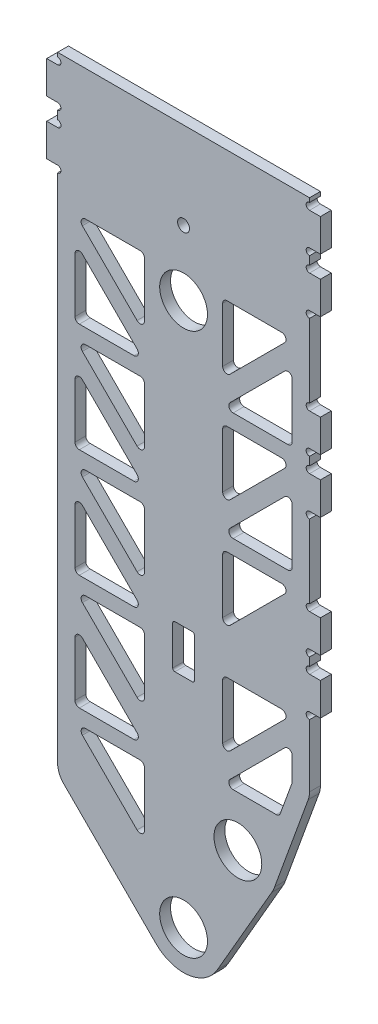
from build123d import *
from build123d.topology import SkipClean

# Parameters (mm, degrees)
SKETCH_1_R                  = 11
EXTRUDE_567_DEPTH           = 100
EXTRUDE_START               = -100
SKETCH_2_R                  = 11
EXTRUDE_876_DEPTH           = 100
EXTRUDE_2692_DEPTH          = 100
CUT_EXTRUDE_4149_DEPTH      = 534.010319
CUT_EXTRUDE_4149_DEPTH_BACK = 534.010319
SKETCH_3_W                  = 90
SKETCH_3_H                  = 380
SKETCH_5_R                  = 2.5
EXTRUDE_4715_DEPTH          = 100
SKETCH_6_W                  = 191.177045
SKETCH_6_H                  = 235.084722
CUT_EXTRUDE_5029_DEPTH      = 84
SKETCH_7_R                  = 75
EXTRUDE_5317_DEPTH          = 5
CUT_EXTRUDE_6099_DEPTH      = 357.195171
CUT_EXTRUDE_6099_DEPTH_BACK = 357.195171
FILLET_2_R                  = 2
MIRROR_START                = 95
MIRROR_1_DEPTH              = 5
CUT_EXTRUDE_START           = -5
CUT_EXTRUDE_12513_OUTLINE_R = 5
CUT_EXTRUDE_12513_DEPTH     = 5
CUT_EXTRUDE_7_DEPTH         = 357.195171
CUT_EXTRUDE_7_DEPTH_BACK    = 357.195171
SKETCH_14_W                 = 10
SKETCH_14_H                 = 20
FILLET_4_R                  = 1
CUT_EXTRUDE_START_2         = -129
SKETCH_15_R                 = 11
CUT_EXTRUDE_8_DEPTH         = 129
SKETCH_17_R                 = 13
CUT_EXTRUDE_10_DEPTH        = 0.75
SKETCH_18_R                 = 11
CUT_EXTRUDE_11_DEPTH        = 113
CUT_EXTRUDE_12_DEPTH        = 357.195171
CUT_EXTRUDE_12_DEPTH_BACK   = 357.195171
MOVE_FACE_1_BY              = 4
SKETCH_25_R                 = 2.75
CUT_EXTRUDE_17_DEPTH        = 10
FILLET_5_R                  = 10
MOVE_FACE_2_BY              = 4
SKETCH_26_W                 = 5
SKETCH_26_H                 = 15
EXTRUDE_7_DEPTH             = 5
SKETCH_27_R                 = 1.55
CUT_EXTRUDE_18_DEPTH        = 5


# Read off the part's stored shape, not the designer's step: 镜向1, 电机安装轴承孔
with BuildPart() as part:
    # 草图1 → Extrude 567 (new body)
    with BuildSketch(Plane.XY):
        with BuildLine():
            Line((-18, 500), (-18, 0))
            ThreePointArc((-18, 0), (0, -18), (18, 0))
            Line((18, 0), (18, 500))
            ThreePointArc((18, 500), (0, 518), (-18, 500))
        make_face()
        with Locations((0, 500)):
            Circle(SKETCH_1_R, mode=Mode.SUBTRACT)
        Circle(SKETCH_1_R, mode=Mode.SUBTRACT)
    extrude(amount=EXTRUDE_567_DEPTH)

    # 草图2 → Extrude 876 (add)
    with BuildSketch(Plane.XY.offset(100).offset(EXTRUDE_START)):
        with BuildLine():
            Line((18, 61.30127), (25, 61.30127))
            ThreePointArc((25, 61.30127), (40.588457, 52.30127), (40.588457, 34.30127))
            Line((40.588457, 34.30127), (15.588457, -9))
            ThreePointArc((15.588457, -9), (-4.658743, -17.386665), (-18, 0))
            Line((-18, 0), (-18, 61.30127))
            Line((-18, 61.30127), (18, 61.30127))
        make_face()
        with Locations((25, 43.30127)):
            Circle(SKETCH_2_R, mode=Mode.SUBTRACT)
        Circle(SKETCH_2_R, mode=Mode.SUBTRACT)
    extrude(amount=EXTRUDE_876_DEPTH)

    # 草图10 → Extrude 2692 (add)
    with BuildSketch(Plane(origin=(0, 0, 0), x_dir=(-1, 0, 0), z_dir=(0, 0, -1))):
        with BuildLine():
            Line((-41.914467, 37.144908), (-58, 81.339546))
            Line((-58, 81.339546), (-58, 320))
            Line((-58, 320), (-18, 320))
            Line((-18, 320), (-18, 61.30127))
            Line((-18, 61.30127), (-25, 61.30127))
            ThreePointArc((-25, 61.30127), (-39.744737, 53.625646), (-41.914467, 37.144908))
        make_face()
        with BuildLine():
            Line((12.727922, -12.727922), (58, 32.544156))
            Line((58, 32.544156), (58, 320))
            Line((58, 320), (18, 320))
            Line((18, 320), (18, 0))
            ThreePointArc((18, 0), (16.629832, -6.888302), (12.727922, -12.727922))
        make_face()
    extrude(amount=-EXTRUDE_2692_DEPTH)

    # 草图3 → Cut-Extrude 4149 (cut, two sides: drawn at the far end of the back side and taken through both)
    with BuildSketch(Plane.ZY.offset(18).offset(-CUT_EXTRUDE_4149_DEPTH_BACK)):
        with Locations((50, 150)):
            Rectangle(SKETCH_3_W, SKETCH_3_H)
    extrude(amount=CUT_EXTRUDE_4149_DEPTH + CUT_EXTRUDE_4149_DEPTH_BACK, mode=Mode.SUBTRACT)

    # 草图5 → Extrude 4715 (add)
    with BuildSketch(Plane.XY.offset(100)):
        with Locations(Location((0, 250, 0), (0, 0, 90))):
            Circle(SKETCH_5_R)
    extrude(amount=-EXTRUDE_4715_DEPTH)

    # 草图6 → Cut-Extrude 5029 (cut)
    with BuildSketch(Plane(origin=(18, 0, 0), x_dir=(0, 0, -1), z_dir=(1, 0, 0))):
        with Locations((-50.962374, 437.542361)):
            Rectangle(SKETCH_6_W, SKETCH_6_H)
    extrude(amount=-CUT_EXTRUDE_5029_DEPTH, mode=Mode.SUBTRACT)

    # 草图7 → Extrude 5317 (add)
    with BuildSketch(Plane(origin=(0, 320, 0), x_dir=(1, 0, 0), z_dir=(0, 1, 0))):
        with Locations(Location((0, -50, 0), (0, 0, 320.65417))):
            Circle(SKETCH_7_R)
    extrude(amount=EXTRUDE_5317_DEPTH)

    # 草图10<3> → Cut-Extrude 6099 (cut, two sides: drawn at the far end of the back side and taken through both)
    with BuildSketch(Plane(origin=(0, 0, 0), x_dir=(-1, 0, 0), z_dir=(0, 0, -1)).offset(-CUT_EXTRUDE_6099_DEPTH_BACK)):
        Polygon((-18, 227.925714), (-18, 259.925714), (-50, 259.925714), align=None)
        Polygon((50, 259.925714), (18, 259.925714), (18, 227.925714), align=None)
        Polygon((50, 248.612005), (50, 216.612005), (18, 216.612005), align=None)
        Polygon((-50, 248.612005), (-50, 216.612005), (-18, 216.612005), align=None)
        Polygon((-18, 177.851427), (-18, 209.851427), (-50, 209.851427), align=None)
        Polygon((50, 209.851427), (18, 209.851427), (18, 177.851427), align=None)
        Polygon((50, 198.537719), (50, 166.537719), (18, 166.537719), align=None)
        Polygon((-50, 198.537719), (-50, 166.537719), (-18, 166.537719), align=None)
        Polygon((-50, 159.777141), (-18, 127.777141), (-18, 159.777141), align=None)
        Polygon((18, 159.777141), (18, 127.777141), (50, 159.777141), align=None)
        Polygon((-50, 109.702854), (-18, 77.702854), (-18, 109.702854), align=None)
        Polygon((18, 109.702854), (18, 77.702854), (50, 109.702854), align=None)
        Polygon((-50, 98.389146), (-50, 82.750162), (-44.045077, 66.389146), (-18, 66.389146), align=None)
        Polygon((18, 56.800141), (18, 24.800141), (50, 56.800141), align=None)
        Polygon((50, 95.560719), (50, 63.560719), (18, 63.560719), align=None)
        Polygon((50, 116.463432), (18, 116.463432), (50, 148.463432), align=None)
    extrude(amount=CUT_EXTRUDE_6099_DEPTH + CUT_EXTRUDE_6099_DEPTH_BACK, mode=Mode.SUBTRACT)

    # 圆角2
    fillet_2_edges = [part.edges().sort_by_distance(p)[0] for p in [
        (50, 159.777141, 2.5),
        (18, 159.777141, 2.5),
        (18, 127.777141, 2.5),
        (50, 166.537719, 2.5),
        (50, 198.537719, 2.5),
        (18, 166.537719, 2.5),
        (-18, 209.851427, 2.5),
        (-50, 209.851427, 2.5),
        (-18, 177.851427, 2.5),
        (-50, 198.537719, 2.5),
        (-50, 166.537719, 2.5),
        (-18, 166.537719, 2.5),
        (50, 209.851427, 2.5),
        (18, 209.851427, 2.5),
        (18, 177.851427, 2.5),
        (50, 216.612005, 2.5),
        (50, 248.612005, 2.5),
        (18, 216.612005, 2.5),
        (-18, 259.925714, 2.5),
        (-50, 259.925714, 2.5),
        (-18, 227.925714, 2.5),
        (-50, 248.612005, 2.5),
        (-50, 216.612005, 2.5),
        (-18, 216.612005, 2.5),
        (-50, 148.463432, 2.5),
        (-50, 116.463432, 2.5),
        (-18, 116.463432, 2.5),
        (-50, 63.560719, 2.5),
        (-18, 63.560719, 2.5),
        (-50, 95.560719, 2.5),
        (-50, 56.800141, 2.5),
        (-18, 24.800141, 2.5),
        (-18, 56.800141, 2.5),
        (-18, 159.777141, 2.5),
        (-50, 159.777141, 2.5),
        (-18, 127.777141, 2.5),
        (50, 109.702854, 2.5),
        (18, 109.702854, 2.5),
        (18, 77.702854, 2.5),
        (-18, 109.702854, 2.5),
        (-50, 109.702854, 2.5),
        (-18, 77.702854, 2.5),
        (50, 82.750162, 2.5),
        (50, 98.389146, 2.5),
        (18, 66.389146, 2.5),
        (44.045077, 66.389146, 2.5),
        (50, 259.925714, 2.5),
        (18, 259.925714, 2.5),
        (18, 227.925714, 2.5),
    ]]
    fillet(fillet_2_edges, radius=FILLET_2_R)

    # 镜向1 outline → 镜向1 (add)
    with BuildSketch(Plane.XY.offset(MIRROR_START)):
        with BuildLine():
            ThreePointArc((-50, 143.635005), (-48.765367, 145.482764), (-46.585786, 145.049219))
            Line((-46.585786, 145.049219), (-50, 148.463432))
            Line((-50, 148.463432), (-50, 143.635005))
        make_face()
        with BuildLine():
            Line((-18, 116.463432), (-21.414214, 119.877646))
            ThreePointArc((-21.414214, 119.877646), (-20.980668, 117.698065), (-22.828427, 116.463432))
            Line((-22.828427, 116.463432), (-18, 116.463432))
        make_face()
        with BuildLine():
            ThreePointArc((-48, 116.463432), (-49.414214, 117.049219), (-50, 118.463432))
            Line((-50, 118.463432), (-50, 116.463432))
            Line((-50, 116.463432), (-48, 116.463432))
        make_face()
        with BuildLine():
            ThreePointArc((-20, 259.925714), (-18.585786, 259.339927), (-18, 257.925714))
            Line((-18, 257.925714), (-18, 259.925714))
            Line((-18, 259.925714), (-20, 259.925714))
        make_face()
        with BuildLine():
            Line((-18, 227.925714), (-18, 232.754141))
            ThreePointArc((-18, 232.754141), (-19.234633, 230.906382), (-21.414214, 231.339927))
            Line((-21.414214, 231.339927), (-18, 227.925714))
        make_face()
        with BuildLine():
            ThreePointArc((-46.585786, 256.5115), (-47.019332, 258.69108), (-45.171573, 259.925714))
            Line((-45.171573, 259.925714), (-50, 259.925714))
            Line((-50, 259.925714), (-46.585786, 256.5115))
        make_face()
        with BuildLine():
            ThreePointArc((-50, 243.783578), (-48.765367, 245.631337), (-46.585786, 245.197791))
            Line((-46.585786, 245.197791), (-50, 248.612005))
            Line((-50, 248.612005), (-50, 243.783578))
        make_face()
        with BuildLine():
            Line((-18, 216.612005), (-21.414214, 220.026219))
            ThreePointArc((-21.414214, 220.026219), (-20.980668, 217.846638), (-22.828427, 216.612005))
            Line((-22.828427, 216.612005), (-18, 216.612005))
        make_face()
        with BuildLine():
            ThreePointArc((-48, 216.612005), (-49.414214, 217.197791), (-50, 218.612005))
            Line((-50, 218.612005), (-50, 216.612005))
            Line((-50, 216.612005), (-48, 216.612005))
        make_face()
        with BuildLine():
            ThreePointArc((-20, 209.851427), (-18.585786, 209.265641), (-18, 207.851427))
            Line((-18, 207.851427), (-18, 209.851427))
            Line((-18, 209.851427), (-20, 209.851427))
        make_face()
        with BuildLine():
            Line((-18, 177.851427), (-18, 182.679854))
            ThreePointArc((-18, 182.679854), (-19.234633, 180.832095), (-21.414214, 181.265641))
            Line((-21.414214, 181.265641), (-18, 177.851427))
        make_face()
        with BuildLine():
            ThreePointArc((-46.585786, 206.437214), (-47.019332, 208.616794), (-45.171573, 209.851427))
            Line((-45.171573, 209.851427), (-50, 209.851427))
            Line((-50, 209.851427), (-46.585786, 206.437214))
        make_face()
        with BuildLine():
            ThreePointArc((-50, 193.709291), (-48.765367, 195.557051), (-46.585786, 195.123505))
            Line((-46.585786, 195.123505), (-50, 198.537719))
            Line((-50, 198.537719), (-50, 193.709291))
        make_face()
        with BuildLine():
            Line((-18, 166.537719), (-21.414214, 169.951932))
            ThreePointArc((-21.414214, 169.951932), (-20.980668, 167.772352), (-22.828427, 166.537719))
            Line((-22.828427, 166.537719), (-18, 166.537719))
        make_face()
        with BuildLine():
            ThreePointArc((-48, 166.537719), (-49.414214, 167.123505), (-50, 168.537719))
            Line((-50, 168.537719), (-50, 166.537719))
            Line((-50, 166.537719), (-48, 166.537719))
        make_face()
        with BuildLine():
            ThreePointArc((-20, 159.777141), (-18.585786, 159.191354), (-18, 157.777141))
            Line((-18, 157.777141), (-18, 159.777141))
            Line((-18, 159.777141), (-20, 159.777141))
        make_face()
        with BuildLine():
            Line((-18, 127.777141), (-18, 132.605568))
            ThreePointArc((-18, 132.605568), (-19.234633, 130.757809), (-21.414214, 131.191354))
            Line((-21.414214, 131.191354), (-18, 127.777141))
        make_face()
        with BuildLine():
            ThreePointArc((-46.585786, 156.362927), (-47.019332, 158.542507), (-45.171573, 159.777141))
            Line((-45.171573, 159.777141), (-50, 159.777141))
            Line((-50, 159.777141), (-46.585786, 156.362927))
        make_face()
        with BuildLine():
            ThreePointArc((-20, 109.702854), (-18.585786, 109.117068), (-18, 107.702854))
            Line((-18, 107.702854), (-18, 109.702854))
            Line((-18, 109.702854), (-20, 109.702854))
        make_face()
        with BuildLine():
            Line((-18, 77.702854), (-18, 82.531281))
            ThreePointArc((-18, 82.531281), (-19.234633, 80.683522), (-21.414214, 81.117068))
            Line((-21.414214, 81.117068), (-18, 77.702854))
        make_face()
        with BuildLine():
            ThreePointArc((-46.585786, 106.288641), (-47.019332, 108.468221), (-45.171573, 109.702854))
            Line((-45.171573, 109.702854), (-50, 109.702854))
            Line((-50, 109.702854), (-46.585786, 106.288641))
        make_face()
        with BuildLine():
            ThreePointArc((-50, 90.732291), (-48.765367, 92.58005), (-46.585786, 92.146505))
            Line((-46.585786, 92.146505), (-50, 95.560719))
            Line((-50, 95.560719), (-50, 90.732291))
        make_face()
        with BuildLine():
            Line((-18, 63.560719), (-21.414214, 66.974932))
            ThreePointArc((-21.414214, 66.974932), (-20.980668, 64.795352), (-22.828427, 63.560719))
            Line((-22.828427, 63.560719), (-18, 63.560719))
        make_face()
        with BuildLine():
            ThreePointArc((-48, 63.560719), (-49.414214, 64.146505), (-50, 65.560719))
            Line((-50, 65.560719), (-50, 63.560719))
            Line((-50, 63.560719), (-48, 63.560719))
        make_face()
        with BuildLine():
            ThreePointArc((-46.585786, 53.385927), (-47.019332, 55.565507), (-45.171573, 56.800141))
            Line((-45.171573, 56.800141), (-50, 56.800141))
            Line((-50, 56.800141), (-46.585786, 53.385927))
        make_face()
        with BuildLine():
            Line((-18, 56.800141), (-20, 56.800141))
            ThreePointArc((-20, 56.800141), (-18.585786, 56.214354), (-18, 54.800141))
            Line((-18, 54.800141), (-18, 56.800141))
        make_face()
        with BuildLine():
            ThreePointArc((-18, 29.628568), (-19.234633, 27.780809), (-21.414214, 28.214354))
            Line((-21.414214, 28.214354), (-18, 24.800141))
            Line((-18, 24.800141), (-18, 29.628568))
        make_face()
        with BuildLine():
            ThreePointArc((46.585786, 94.974932), (48.765367, 95.408478), (50, 93.560719))
            Line((50, 93.560719), (50, 98.389146))
            Line((50, 98.389146), (46.585786, 94.974932))
        make_face()
        with BuildLine():
            Line((50, 82.750162), (50, 83.102816))
            ThreePointArc((50, 83.102816), (49.969616, 82.755519), (49.879385, 82.418775))
            Line((49.879385, 82.418775), (50, 82.750162))
        make_face()
        with BuildLine():
            ThreePointArc((22.828427, 66.389146), (20.980668, 67.623779), (21.414214, 69.803359))
            Line((21.414214, 69.803359), (18, 66.389146))
            Line((18, 66.389146), (22.828427, 66.389146))
        make_face()
        with BuildLine():
            Line((44.045077, 66.389146), (44.524047, 67.705105))
            ThreePointArc((44.524047, 67.705105), (43.791815, 66.750842), (42.644662, 66.389146))
            Line((42.644662, 66.389146), (44.045077, 66.389146))
        make_face()
        with BuildLine():
            Line((18, 109.702854), (18, 107.702854))
            ThreePointArc((18, 107.702854), (18.585786, 109.117068), (20, 109.702854))
            Line((20, 109.702854), (18, 109.702854))
        make_face()
        with BuildLine():
            ThreePointArc((21.414214, 81.117068), (19.234633, 80.683522), (18, 82.531281))
            Line((18, 82.531281), (18, 77.702854))
            Line((18, 77.702854), (21.414214, 81.117068))
        make_face()
        with BuildLine():
            Line((50, 109.702854), (45.171573, 109.702854))
            ThreePointArc((45.171573, 109.702854), (47.019332, 108.468221), (46.585786, 106.288641))
            Line((46.585786, 106.288641), (50, 109.702854))
        make_face()
        with BuildLine():
            Line((18, 159.777141), (18, 157.777141))
            ThreePointArc((18, 157.777141), (18.585786, 159.191354), (20, 159.777141))
            Line((20, 159.777141), (18, 159.777141))
        make_face()
        with BuildLine():
            ThreePointArc((21.414214, 131.191354), (19.234633, 130.757809), (18, 132.605568))
            Line((18, 132.605568), (18, 127.777141))
            Line((18, 127.777141), (21.414214, 131.191354))
        make_face()
        with BuildLine():
            Line((50, 159.777141), (45.171573, 159.777141))
            ThreePointArc((45.171573, 159.777141), (47.019332, 158.542507), (46.585786, 156.362927))
            Line((46.585786, 156.362927), (50, 159.777141))
        make_face()
        with BuildLine():
            ThreePointArc((50, 168.537719), (49.414214, 167.123505), (48, 166.537719))
            Line((48, 166.537719), (50, 166.537719))
            Line((50, 166.537719), (50, 168.537719))
        make_face()
        with BuildLine():
            Line((18, 166.537719), (22.828427, 166.537719))
            ThreePointArc((22.828427, 166.537719), (20.980668, 167.772352), (21.414214, 169.951932))
            Line((21.414214, 169.951932), (18, 166.537719))
        make_face()
        with BuildLine():
            ThreePointArc((46.585786, 195.123505), (48.765367, 195.557051), (50, 193.709291))
            Line((50, 193.709291), (50, 198.537719))
            Line((50, 198.537719), (46.585786, 195.123505))
        make_face()
        with BuildLine():
            Line((18, 177.851427), (21.414214, 181.265641))
            ThreePointArc((21.414214, 181.265641), (19.234633, 180.832095), (18, 182.679854))
            Line((18, 182.679854), (18, 177.851427))
        make_face()
        with BuildLine():
            ThreePointArc((45.171573, 209.851427), (47.019332, 208.616794), (46.585786, 206.437214))
            Line((46.585786, 206.437214), (50, 209.851427))
            Line((50, 209.851427), (45.171573, 209.851427))
        make_face()
        with BuildLine():
            Line((18, 209.851427), (18, 207.851427))
            ThreePointArc((18, 207.851427), (18.585786, 209.265641), (20, 209.851427))
            Line((20, 209.851427), (18, 209.851427))
        make_face()
        with BuildLine():
            ThreePointArc((50, 218.612005), (49.414214, 217.197791), (48, 216.612005))
            Line((48, 216.612005), (50, 216.612005))
            Line((50, 216.612005), (50, 218.612005))
        make_face()
        with BuildLine():
            Line((18, 216.612005), (22.828427, 216.612005))
            ThreePointArc((22.828427, 216.612005), (20.980668, 217.846638), (21.414214, 220.026219))
            Line((21.414214, 220.026219), (18, 216.612005))
        make_face()
        with BuildLine():
            ThreePointArc((46.585786, 245.197791), (48.765367, 245.631337), (50, 243.783578))
            Line((50, 243.783578), (50, 248.612005))
            Line((50, 248.612005), (46.585786, 245.197791))
        make_face()
        with BuildLine():
            Line((18, 227.925714), (21.414214, 231.339927))
            ThreePointArc((21.414214, 231.339927), (19.234633, 230.906382), (18, 232.754141))
            Line((18, 232.754141), (18, 227.925714))
        make_face()
        with BuildLine():
            ThreePointArc((45.171573, 259.925714), (47.019332, 258.69108), (46.585786, 256.5115))
            Line((46.585786, 256.5115), (50, 259.925714))
            Line((50, 259.925714), (45.171573, 259.925714))
        make_face()
        with BuildLine():
            Line((18, 259.925714), (18, 257.925714))
            ThreePointArc((18, 257.925714), (18.585786, 259.339927), (20, 259.925714))
            Line((20, 259.925714), (18, 259.925714))
        make_face()
    extrude(amount=MIRROR_1_DEPTH)

    # Cut-Extrude 12513 outline → Cut-Extrude 12513 (cut)
    with BuildSketch(Plane.XY.offset(5).offset(CUT_EXTRUDE_START)):
        with Locations((0, 250)):
            Circle(CUT_EXTRUDE_12513_OUTLINE_R)
    cut_extrude_12513 = extrude(amount=CUT_EXTRUDE_12513_DEPTH, mode=Mode.SUBTRACT)

    # 镜向2: Cut-Extrude 12513 across plane
    add(cut_extrude_12513.mirror(Plane(origin=(0, 0, 50), x_dir=(1, 0, 0), z_dir=(0, 0, -1))), mode=Mode.SUBTRACT)

    # 草图14 → 切除-拉伸7 (cut, two sides: drawn at the far end of the back side and taken through both)
    with BuildSketch(Plane(origin=(0, 0, 0), x_dir=(-1, 0, 0), z_dir=(0, 0, -1)).offset(-CUT_EXTRUDE_7_DEPTH_BACK)):
        with Locations((0, 110)):
            Rectangle(SKETCH_14_W, SKETCH_14_H)
    extrude(amount=CUT_EXTRUDE_7_DEPTH + CUT_EXTRUDE_7_DEPTH_BACK, mode=Mode.SUBTRACT)

    # 圆角4
    fillet_4_edges = [part.edges().sort_by_distance(p)[0] for p in [
        (5, 100, 2.5),
        (5, 120, 2.5),
        (-5, 120, 2.5),
        (-5, 100, 2.5),
        (5, 100, 97.5),
        (5, 120, 97.5),
        (-5, 120, 97.5),
        (-5, 100, 97.5),
    ]]
    fillet(fillet_4_edges, radius=FILLET_4_R)

    # 草图15 → 切除-拉伸8 (cut)
    with BuildSketch(Plane.XY.offset(100).offset(CUT_EXTRUDE_START_2)):
        with Locations((25, 43.30127)):
            Circle(SKETCH_15_R)
    extrude(amount=CUT_EXTRUDE_8_DEPTH, mode=Mode.SUBTRACT)

    # 草图17 → 切除-拉伸10 (cut)
    with BuildSketch(Plane(origin=(0, 0, 0), x_dir=(-1, 0, 0), z_dir=(0, 0, -1))):
        Circle(SKETCH_17_R)
        with Locations((-25, 43.30127)):
            Circle(SKETCH_17_R)
    extrude(amount=-CUT_EXTRUDE_10_DEPTH, mode=Mode.SUBTRACT)

    # 草图18 → 切除-拉伸11 (cut)
    with BuildSketch(Plane.XY.offset(100)):
        with Locations((0, 250)):
            Circle(SKETCH_18_R)
    extrude(amount=-CUT_EXTRUDE_11_DEPTH, mode=Mode.SUBTRACT)

    # 草图20 → 切除-拉伸12 (cut, two sides: drawn at the far end of the back side and taken through both)
    with BuildSketch(Plane(origin=(0, 0, 0), x_dir=(0, 0, -1), z_dir=(1, 0, 0)).offset(-CUT_EXTRUDE_12_DEPTH_BACK)):
        Polygon((25, 325), (-125, 325), (-125, 320), (-25.335633, 320), (-25.335633, -69.714062), (25, -69.714062), align=None)
    extrude(amount=CUT_EXTRUDE_12_DEPTH + CUT_EXTRUDE_12_DEPTH_BACK, mode=Mode.SUBTRACT)

    # Move Face 1: a face moved outward by 4.0
    extrude(part.faces().sort_by_distance((-0.404378, 169.813688, 95))[0], amount=MOVE_FACE_1_BY, dir=(0, 0, -1))

    # 草图25 → 切除-拉伸17 (cut)
    with SkipClean():  # the faces are left unmerged after this step: merging them gives an invalid solid
        with BuildSketch(Plane.XY.offset(100)):
            with Locations((0, 280)):
                Circle(SKETCH_25_R)
        extrude(amount=-CUT_EXTRUDE_17_DEPTH, mode=Mode.SUBTRACT)

    # 圆角5
    fillet_5_edges = [part.edges().sort_by_distance(p)[0] for p in [
        (-58, 32.544156, 97.5),
        (58, 81.339546, 97.5),
    ]]
    fillet(fillet_5_edges, radius=FILLET_5_R)

    # Move Face 2: a face moved inward by 4.0
    extrude(part.faces().sort_by_distance((-0.400503, 169.726512, 91))[0], amount=MOVE_FACE_2_BY, dir=(0, 0, 1), mode=Mode.SUBTRACT)

    # 草图26 → 凸台-拉伸7 (add)
    with BuildSketch(Plane(origin=(0, 0, 95), x_dir=(-1, 0, 0), z_dir=(0, 0, -1))):
        with Locations((60.5, 307.5)):
            Rectangle(SKETCH_26_W, SKETCH_26_H)
        with Locations((60.5, 282.5)):
            Rectangle(SKETCH_26_W, SKETCH_26_H)
        with Locations((-60.5, 282.5)):
            Rectangle(SKETCH_26_W, SKETCH_26_H)
        with Locations((-60.5, 307.5)):
            Rectangle(SKETCH_26_W, SKETCH_26_H)
        with Locations((-60.5, 227.5)):
            Rectangle(SKETCH_26_W, SKETCH_26_H)
        with Locations((-60.5, 202.5)):
            Rectangle(SKETCH_26_W, SKETCH_26_H)
        with Locations((-60.5, 147.5)):
            Rectangle(SKETCH_26_W, SKETCH_26_H)
        with Locations((-60.5, 122.5)):
            Rectangle(SKETCH_26_W, SKETCH_26_H)
    extrude(amount=-EXTRUDE_7_DEPTH)

    # 草图27 → 切除-拉伸18 (cut)
    with BuildSketch(Plane(origin=(0, 0, 95), x_dir=(-1, 0, 0), z_dir=(0, 0, -1))):
        with Locations((58, 316.55)):
            Circle(SKETCH_27_R)
        with Locations((58, 298.45)):
            Circle(SKETCH_27_R)
        with Locations((58, 291.55)):
            Circle(SKETCH_27_R)
        with Locations((58, 273.45)):
            Circle(SKETCH_27_R)
        with Locations((-58, 273.45)):
            Circle(SKETCH_27_R)
        with Locations((-58, 291.55)):
            Circle(SKETCH_27_R)
        with Locations((-58, 298.45)):
            Circle(SKETCH_27_R)
        with Locations((-58, 316.55)):
            Circle(SKETCH_27_R)
        with Locations((-58, 236.55)):
            Circle(SKETCH_27_R)
        with Locations((-58, 218.45)):
            Circle(SKETCH_27_R)
        with Locations((-58, 211.55)):
            Circle(SKETCH_27_R)
        with Locations((-58, 193.45)):
            Circle(SKETCH_27_R)
        with Locations((-58, 156.55)):
            Circle(SKETCH_27_R)
        with Locations((-58, 138.45)):
            Circle(SKETCH_27_R)
        with Locations((-58, 131.55)):
            Circle(SKETCH_27_R)
        with Locations((-58, 113.45)):
            Circle(SKETCH_27_R)
    extrude(amount=-CUT_EXTRUDE_18_DEPTH, mode=Mode.SUBTRACT)


solid = part.part
